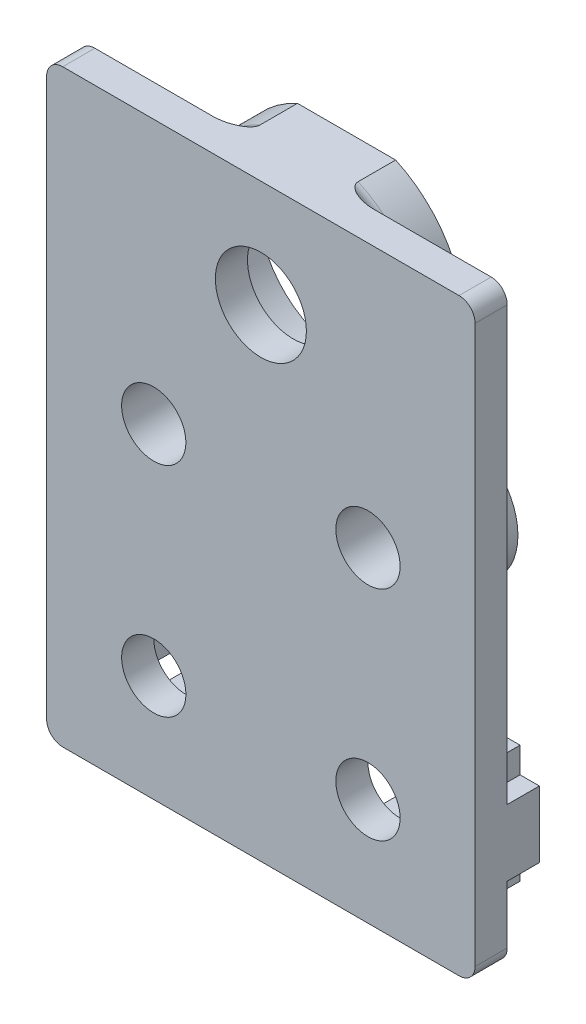
from build123d import *

# Parameters (mm, degrees)
SKETCH_1_R          = 2.55
EXTRUDE_1_DEPTH     = 10
SKETCH_2_W          = 40
SKETCH_2_H          = 20
EXTRUDE_2_DEPTH     = 3
EXTRUDE_3_DEPTH     = 3
CUT_EXTRUDE_1_DEPTH = 10
SKETCH_5_R          = 3
CUT_EXTRUDE_2_DEPTH = 10
SKETCH_6_R          = 3
SKETCH_6_R_2        = 4.25
EXTRUDE_4_DEPTH     = 3
FILLET_1_R          = 1.5
SKETCH_7_R          = 6
SKETCH_7_R_2        = 3
EXTRUDE_5_DEPTH     = 5
SKETCH_8_R          = 8.25
EXTRUDE_6_DEPTH     = 5
FILLET_3_R          = 1.5


with BuildPart() as part:
    # 草图1 → 凸台-拉伸1 (new body)
    with BuildSketch(Plane.XY):
        Polygon((-20, 0), (-20, -6.9), (-18.2, -6.9), (-18.2, -4.5), (-16.560660172, -4.5), (-13.9, -7.160660172), (-13.9, -12.839339828), (-16.560660172, -15.5), (-18.2, -15.5), (-18.2, -13.1), (-20, -13.1), (-20, -20), (-13.1, -20), (-13.1, -18.2), (-15.5, -18.2), (-15.5, -16.560660172), (-12.839339828, -13.9), (-7.160660172, -13.9), (-4.5, -16.560660172), (-4.5, -18.2), (-6.9, -18.2), (-6.9, -20), (0, -20), (6.9, -20), (6.9, -18.2), (4.5, -18.2), (4.5, -16.560660172), (7.160660172, -13.9), (12.839339828, -13.9), (15.5, -16.560660172), (15.5, -18.2), (13.1, -18.2), (13.1, -20), (20, -20), (20, -13.1), (18.2, -13.1), (18.2, -15.5), (16.560660172, -15.5), (13.9, -12.839339828), (13.9, -7.160660172), (16.560660172, -4.5), (18.2, -4.5), (18.2, -6.9), (20, -6.9), (20, 0), (13.1, 0), (13.1, -1.8), (15.5, -1.8), (15.5, -3.439339828), (12.839339828, -6.1), (7.160660172, -6.1), (4.5, -3.439339828), (4.5, -1.8), (6.9, -1.8), (6.9, 0), (0, 0), (-6.9, 0), (-6.9, -1.8), (-4.5, -1.8), (-4.5, -3.439339828), (-7.160660172, -6.1), (-12.839339828, -6.1), (-15.5, -3.439339828), (-15.5, -1.8), (-13.1, -1.8), (-13.1, 0), align=None)
        with Locations((-10, -10)):
            Circle(SKETCH_1_R, mode=Mode.SUBTRACT)
        with Locations((10, -10)):
            Circle(SKETCH_1_R, mode=Mode.SUBTRACT)
        Polygon((-3.439339828, -4.5), (-6.1, -7.160660172), (-6.1, -12.839339828), (-3.439339828, -15.5), (-3.439339828, -18.2), (3.439339828, -18.2), (3.439339828, -15.5), (6.1, -12.839339828), (6.1, -7.160660172), (3.439339828, -4.5), (3.439339828, -1.8), (-3.439339828, -1.8), align=None, mode=Mode.SUBTRACT)
    extrude(amount=EXTRUDE_1_DEPTH)

    # 草图2 → 凸台-拉伸2 (add)
    with BuildSketch(Plane.XY.offset(10)):
        with Locations((0, -10)):
            Rectangle(SKETCH_2_W, SKETCH_2_H)
    extrude(amount=EXTRUDE_2_DEPTH)

    # 草图3 → 凸台-拉伸3 (add)
    with BuildSketch(Plane(origin=(0, 0, 10), x_dir=(-1, 0, 0), z_dir=(0, 0, -1))):
        Polygon((-13.1, -20), (-6.9, -20), (-6.9, -18.2), (-4.5, -18.2), (-4.5, -16.560660172), (-7.160660172, -13.9), (-12.839339828, -13.9), (-15.5, -16.560660172), (-15.5, -18.2), (-13.1, -18.2), align=None)
        Polygon((-20, -6.9), (-20, -13.1), (-18.2, -13.1), (-18.2, -15.5), (-16.560660172, -15.5), (-13.9, -12.839339828), (-13.9, -7.160660172), (-16.560660172, -4.5), (-18.2, -4.5), (-18.2, -6.9), align=None)
        Polygon((-6.9, 0), (-13.1, 0), (-13.1, -1.8), (-15.5, -1.8), (-15.5, -3.439339828), (-12.839339828, -6.1), (-7.160660172, -6.1), (-4.5, -3.439339828), (-4.5, -1.8), (-6.9, -1.8), align=None)
        Polygon((6.9, -20), (13.1, -20), (13.1, -18.2), (15.5, -18.2), (15.5, -16.560660172), (12.839339828, -13.9), (7.160660172, -13.9), (4.5, -16.560660172), (4.5, -18.2), (6.9, -18.2), align=None)
        Polygon((20, -13.1), (20, -6.9), (18.2, -6.9), (18.2, -4.5), (16.560660172, -4.5), (13.9, -7.160660172), (13.9, -12.839339828), (16.560660172, -15.5), (18.2, -15.5), (18.2, -13.1), align=None)
        Polygon((13.1, 0), (6.9, 0), (6.9, -1.8), (4.5, -1.8), (4.5, -3.439339828), (7.160660172, -6.1), (12.839339828, -6.1), (15.5, -3.439339828), (15.5, -1.8), (13.1, -1.8), align=None)
    extrude(amount=EXTRUDE_3_DEPTH)

    # 草图4 → 切除-拉伸1 (cut)
    with BuildSketch(Plane(origin=(0, 0, 0), x_dir=(-1, 0, 0), z_dir=(0, 0, -1))):
        Polygon((6.9, 0), (-6.9, 0), (-6.9, -1.8), (-4.5, -1.8), (-4.5, -3.439339828), (-7.160660172, -6.1), (-12.839339828, -6.1), (-15.5, -3.439339828), (-15.5, -1.8), (-13.1, -1.8), (-13.1, 0), (-20, 0), (-20, -6.9), (-18.2, -6.9), (-18.2, -4.5), (-16.560660172, -4.5), (-13.9, -7.160660172), (-13.9, -12.839339828), (-16.560660172, -15.5), (-18.2, -15.5), (-18.2, -13.1), (-20, -13.1), (-20, -20), (-13.1, -20), (-13.1, -18.2), (-15.5, -18.2), (-15.5, -16.560660172), (-12.839339828, -13.9), (-7.160660172, -13.9), (-4.5, -16.560660172), (-4.5, -18.2), (-6.9, -18.2), (-6.9, -20), (6.9, -20), (6.9, -18.2), (4.5, -18.2), (4.5, -16.560660172), (7.160660172, -13.9), (12.839339828, -13.9), (15.5, -16.560660172), (15.5, -18.2), (13.1, -18.2), (13.1, -20), (20, -20), (20, -13.1), (18.2, -13.1), (18.2, -15.5), (16.560660172, -15.5), (13.9, -12.839339828), (13.9, -7.160660172), (16.560660172, -4.5), (18.2, -4.5), (18.2, -6.9), (20, -6.9), (20, 0), (13.1, 0), (13.1, -1.8), (15.5, -1.8), (15.5, -3.439339828), (12.839339828, -6.1), (7.160660172, -6.1), (4.5, -3.439339828), (4.5, -1.8), (6.9, -1.8), align=None)
    extrude(amount=-CUT_EXTRUDE_1_DEPTH, mode=Mode.SUBTRACT)

    # 草图5 → 切除-拉伸2 (cut)
    with BuildSketch(Plane(origin=(0, 0, 10), x_dir=(-1, 0, 0), z_dir=(0, 0, -1))):
        with Locations((-10, -10)):
            Circle(SKETCH_5_R)
        with Locations((10, -10)):
            Circle(SKETCH_5_R)
    extrude(amount=-CUT_EXTRUDE_2_DEPTH, mode=Mode.SUBTRACT)

    # 草图6 → 凸台-拉伸4 (add)
    with BuildSketch(Plane.XY.offset(13)):
        Polygon((-20, 0), (20, 0), (20, 35), (0, 35), (-20, 35), align=None)
        with Locations((-10, 10.36)):
            Circle(SKETCH_6_R, mode=Mode.SUBTRACT)
        with Locations((10, 10.36)):
            Circle(SKETCH_6_R, mode=Mode.SUBTRACT)
        with Locations((0, 25)):
            Circle(SKETCH_6_R_2, mode=Mode.SUBTRACT)
    extrude(amount=-EXTRUDE_4_DEPTH)

    # 圆角1
    fillet_1_edges = [part.edges().sort_by_distance(p)[0] for p in [
        (20, -20, 11.5),
        (-20, -20, 11.5),
        (-20, 35, 11.5),
        (20, 35, 11.5),
    ]]
    fillet(fillet_1_edges, radius=FILLET_1_R)

    # 草图7 → 凸台-拉伸5 (add)
    # profile 1 of 2: a face of its own
    with BuildSketch(Plane(origin=(0, 0, 10), x_dir=(-1, 0, 0), z_dir=(0, 0, -1))):
        with Locations(Location((-10, 10.36, 0), (0, 0, 180))):
            Circle(SKETCH_7_R)
        with Locations(Location((-10, 10.36, 0), (0, 0, 180))):
            Circle(SKETCH_7_R_2, mode=Mode.SUBTRACT)
    # profile 2 of 2: a face of its own
    with BuildSketch(Plane(origin=(0, 0, 10), x_dir=(-1, 0, 0), z_dir=(0, 0, -1))):
        with Locations(Location((10, 10.36, 0), (0, 0, 180))):
            Circle(SKETCH_7_R)
        with Locations(Location((10, 10.36, 0), (0, 0, 180))):
            Circle(SKETCH_7_R_2, mode=Mode.SUBTRACT)
    extrude(amount=EXTRUDE_5_DEPTH)

    # 草图8 → 凸台-拉伸6 (add)
    with BuildSketch(Plane(origin=(0, 0, 10), x_dir=(-1, 0, 0), z_dir=(0, 0, -1))):
        with BuildLine():
            Line((-4.582575695, 35), (4.582575695, 35))
            ThreePointArc((4.582575695, 35), (0, 14), (-4.582575695, 35))
        make_face()
        with Locations((0, 25)):
            Circle(SKETCH_8_R, mode=Mode.SUBTRACT)
    extrude(amount=EXTRUDE_6_DEPTH)

    # 圆角3
    # the kernel refuses this fillet: 1.5 mm, written as the material it adds along each edge
    with BuildSketch(Plane(origin=(10, 10.36, 10), x_dir=(1, 0, 0), z_dir=(0, 1, 0))) as fillet_3_piece_1:
        with BuildLine():
            CenterArc((6 + FILLET_3_R, FILLET_3_R), FILLET_3_R, 180, 90)
            Line((6, FILLET_3_R), (6 - FILLET_3_R * 0.02, FILLET_3_R))
            Line((6 - FILLET_3_R * 0.02, FILLET_3_R), (6 - FILLET_3_R * 0.02, -FILLET_3_R * 0.02))
            Line((6 - FILLET_3_R * 0.02, -FILLET_3_R * 0.02), (6 + FILLET_3_R, -FILLET_3_R * 0.02))
            Line((6 + FILLET_3_R, -FILLET_3_R * 0.02), (6 + FILLET_3_R, 0))
        make_face()
    revolve(axis=Axis((10, 10.36, 10), (0, 0, -1)))
    with BuildSketch(Plane(origin=(-10, 10.36, 10), x_dir=(1, 0, 0), z_dir=(0, 1, 0))) as fillet_3_piece_2:
        with BuildLine():
            CenterArc((6 + FILLET_3_R, FILLET_3_R), FILLET_3_R, 180, 90)
            Line((6, FILLET_3_R), (6 - FILLET_3_R * 0.02, FILLET_3_R))
            Line((6 - FILLET_3_R * 0.02, FILLET_3_R), (6 - FILLET_3_R * 0.02, -FILLET_3_R * 0.02))
            Line((6 - FILLET_3_R * 0.02, -FILLET_3_R * 0.02), (6 + FILLET_3_R, -FILLET_3_R * 0.02))
            Line((6 + FILLET_3_R, -FILLET_3_R * 0.02), (6 + FILLET_3_R, 0))
        make_face()
    revolve(axis=Axis((-10, 10.36, 10), (0, 0, -1)))
    with BuildSketch(Plane(origin=(0, 25, 10), x_dir=(-0.08704252820230896, 0.9962045965985854, 0), z_dir=(0.9962045965985854, 0.08704252820230896, 0))) as fillet_3_piece_3_section:
        with BuildLine():
            CenterArc((11 + FILLET_3_R, -FILLET_3_R), FILLET_3_R, 90, 90)
            Line((11, -FILLET_3_R), (11 - FILLET_3_R * 0.02, -FILLET_3_R))
            Line((11 - FILLET_3_R * 0.02, -FILLET_3_R), (11 - FILLET_3_R * 0.02, FILLET_3_R * 0.02))
            Line((11 - FILLET_3_R * 0.02, FILLET_3_R * 0.02), (11 + FILLET_3_R, FILLET_3_R * 0.02))
            Line((11 + FILLET_3_R, FILLET_3_R * 0.02), (11 + FILLET_3_R, 0))
        make_face()
    fillet_3_piece_3 = revolve(axis=Axis((0, 25, 10), (0, 0, 1)), revolution_arc=350.013022923, mode=Mode.PRIVATE)
    fillet_3_piece_3 = split(fillet_3_piece_3, bisect_by=Plane(origin=(0, 35, 9.583684296), z_dir=(0, -1, 0)), keep=Keep.TOP, mode=Mode.PRIVATE)
    add(fillet_3_piece_3)


solid = part.part
